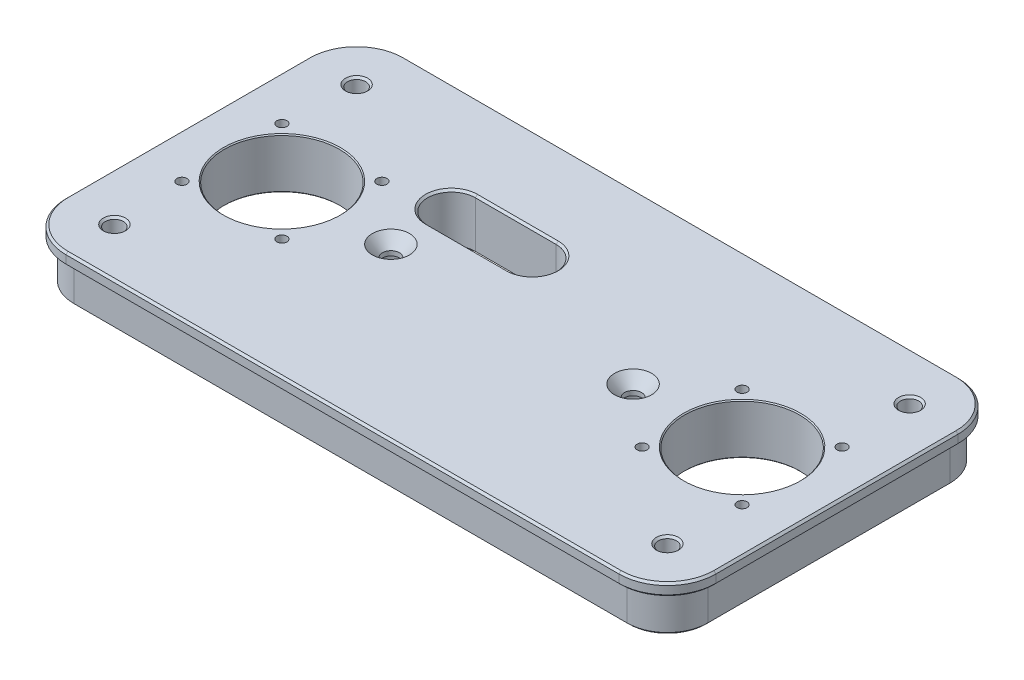
from build123d import *

# Parameters (mm, degrees)
SKETCH1_W                                            = 314
SKETCH1_H                                            = 160
BOSS_EXTRUDE1_DEPTH                                  = 25
SKETCH2_R                                            = 28.5
CUT_EXTRUDE1_DEPTH                                   = 178.971907896
CUT_EXTRUDE2_DEPTH                                   = 178.971907896
CUT_EXTRUDE2_DEPTH_BACK                              = 178.971907896
SKETCH4_R                                            = 9.55
CHAMFER1_SIZE                                        = 0.5
FILLET1_R                                            = 20
M8_CLEARANCE_HOLE1_D                                 = 9
M6X1_0_TAPPED_HOLE1_D                                = 5
SKETCH13_R                                           = 13.411040831
SKETCH13_R_2                                         = 14.724493856
BOSS_EXTRUDE3_DEPTH                                  = 8
CSK_FOR_5_16_FLAT_HEAD_SOCKET_CAP_SCREW1_D           = 8.4328
CSK_FOR_5_16_FLAT_HEAD_SOCKET_CAP_SCREW1_CSINK_D     = 18.4009792
CSK_FOR_5_16_FLAT_HEAD_SOCKET_CAP_SCREW1_CSINK_ANGLE = 82
BOSS_EXTRUDE4_DEPTH                                  = 6
CUT_EXTRUDE3_DEPTH                                   = 184.308483164
CHAMFER4_SIZE                                        = 1


with BuildPart() as part:
    # Sketch1 → Boss-Extrude1 (new body)
    with BuildSketch(Plane(origin=(0, 0, 0), x_dir=(1, 0, 0), z_dir=(0, 1, 0))):
        Rectangle(SKETCH1_W, SKETCH1_H)
    extrude(amount=BOSS_EXTRUDE1_DEPTH)

    # Sketch2 → Cut-Extrude1 (cut, through all)
    with BuildSketch(Plane(origin=(0, 25, 0), x_dir=(1, 0, 0), z_dir=(0, 1, 0))):
        with Locations((-114, 0)):
            Circle(SKETCH2_R)
        with Locations((114, 0)):
            Circle(SKETCH2_R)
    extrude(amount=-CUT_EXTRUDE1_DEPTH, mode=Mode.SUBTRACT)

    # Sketch4 → Cut-Extrude2 (cut, two sides: drawn at the far end of the back side and taken through both)
    with BuildSketch(Plane(origin=(0, 25, 0), x_dir=(1, 0, 0), z_dir=(0, 1, 0)).offset(-CUT_EXTRUDE2_DEPTH_BACK)):
        with Locations((-60, 0)):
            Circle(SKETCH4_R)
        with Locations((60, 0)):
            Circle(SKETCH4_R)
    extrude(amount=CUT_EXTRUDE2_DEPTH + CUT_EXTRUDE2_DEPTH_BACK, mode=Mode.SUBTRACT)

    # Chamfer1
    chamfer1_edges = [part.edges().sort_by_distance(p)[0] for p in [
        (85.5, 25, 0),
        (85.5, 0, 0),
        (50.45, 25, 0),
        (50.45, 0, 0),
        (-69.55, 25, 0),
        (-69.55, 0, 0),
        (-142.5, 25, 0),
        (-142.5, 0, 0),
    ]]
    chamfer(chamfer1_edges, length=CHAMFER1_SIZE)

    # Fillet1
    fillet1_edges = [part.edges().sort_by_distance(p)[0] for p in [
        (157, 12.5, 80),
        (157, 12.5, -80),
        (-157, 12.5, -80),
        (-157, 12.5, 80),
    ]]
    fillet(fillet1_edges, radius=FILLET1_R)

    # M8 Clearance Hole1 (through all)
    with Locations(Plane.XZ):
        with Locations((-137, -60), (-137, 60), (137, -60), (137, 60)):
            Hole(M8_CLEARANCE_HOLE1_D / 2)

    # M6x1.0 Tapped Hole1 (through all)
    with Locations(Plane(origin=(0, 0, 0), x_dir=(-1, 0, 0), z_dir=(0, -1, 0))):
        with Locations((138.765, -24.765), (89.235, -24.765), (89.235, 24.765), (138.765, 24.765), (-89.235, -24.765), (-138.765, -24.765), (-89.235, 24.765), (-138.765, 24.765)):
            Hole(M6X1_0_TAPPED_HOLE1_D / 2)

    # Sketch13 → Boss-Extrude3 (add)
    with BuildSketch(Plane(origin=(0, 25, 0), x_dir=(1, 0, 0), z_dir=(0, 1, 0))):
        with Locations((60, 0)):
            Circle(SKETCH13_R)
        with Locations((-60, 0)):
            Circle(SKETCH13_R_2)
    extrude(amount=-BOSS_EXTRUDE3_DEPTH)

    # CSK for 5/16 Flat Head Socket Cap Screw1 (through all)
    with Locations(Plane(origin=(0, 25, 0), x_dir=(1, 0, 0), z_dir=(0, 1, 0))):
        with Locations((60, 0), (-60, 0)):
            CounterSinkHole(CSK_FOR_5_16_FLAT_HEAD_SOCKET_CAP_SCREW1_D / 2, CSK_FOR_5_16_FLAT_HEAD_SOCKET_CAP_SCREW1_CSINK_D / 2, counter_sink_angle=CSK_FOR_5_16_FLAT_HEAD_SOCKET_CAP_SCREW1_CSINK_ANGLE)

    # Sketch16 → Boss-Extrude4 (add)
    with BuildSketch(Plane.XZ.offset(-25)):
        with BuildLine():
            Line((161, -60), (161, 60))
            ThreePointArc((161, 60), (153.970562748, 76.970562748), (137, 84))
            Line((137, 84), (-137, 84))
            ThreePointArc((-137, 84), (-153.970562748, 76.970562748), (-161, 60))
            Line((-161, 60), (-161, -60))
            ThreePointArc((-161, -60), (-153.970562748, -76.970562748), (-137, -84))
            Line((-137, -84), (137, -84))
            ThreePointArc((137, -84), (153.970562748, -76.970562748), (161, -60))
        make_face()
        with BuildLine():
            Line((157, 60), (157, -60))
            ThreePointArc((157, -60), (151.142135624, -74.142135624), (137, -80))
            Line((137, -80), (-137, -80))
            ThreePointArc((-137, -80), (-151.142135624, -74.142135624), (-157, -60))
            Line((-157, -60), (-157, 60))
            ThreePointArc((-157, 60), (-151.142135624, 74.142135624), (-137, 80))
            Line((-137, 80), (137, 80))
            ThreePointArc((137, 80), (151.142135624, 74.142135624), (157, 60))
        make_face(mode=Mode.SUBTRACT)
    extrude(amount=BOSS_EXTRUDE4_DEPTH)

    # Sketch17 → Cut-Extrude3 (cut, through all)
    with BuildSketch(Plane.XZ):
        with BuildLine():
            Line((-60, -18.184097247), (-20, -18.184097247))
            ThreePointArc((-20, -18.184097247), (-8.164859361, -30.019237886), (-20, -41.854378525))
            Line((-20, -41.854378525), (-60, -41.854378525))
            ThreePointArc((-60, -41.854378525), (-71.835140639, -30.019237886), (-60, -18.184097247))
        make_face()
    extrude(amount=-CUT_EXTRUDE3_DEPTH, mode=Mode.SUBTRACT)

    # Chamfer4
    chamfer4_edges = [part.edges().sort_by_distance(p)[0] for p in [
        (141.5, 0, -60),
        (141.5, 25, -60),
        (-132.5, 0, -60),
        (-132.5, 25, -60),
        (141.5, 0, 60),
        (141.5, 25, 60),
        (-132.5, 0, 60),
        (-132.5, 25, 60),
        (0, 19, -84),
        (153.970562748, 19, -76.970562748),
        (-153.970562748, 19, -76.970562748),
        (161, 19, 0),
        (-161, 19, 0),
        (153.970562748, 19, 76.970562748),
        (-153.970562748, 19, 76.970562748),
        (0, 19, 84),
        (0, 25, -84),
        (153.970562748, 25, -76.970562748),
        (-153.970562748, 25, -76.970562748),
        (161, 25, 0),
        (-161, 25, 0),
        (153.970562748, 25, 76.970562748),
        (-153.970562748, 25, 76.970562748),
        (0, 25, 84),
        (-40, 25, -18.184097247),
        (-71.835140639, 25, -30.019237886),
        (-8.164859361, 25, -30.019237886),
        (-40, 25, -41.854378525),
        (-40, 0, -18.184097247),
        (-71.835140639, 0, -30.019237886),
        (-8.164859361, 0, -30.019237886),
        (-40, 0, -41.854378525),
        (0, 0, -80),
        (-151.142135624, 0, -74.142135624),
        (151.142135624, 0, -74.142135624),
        (-157, 0, 0),
        (157, 0, 0),
        (-151.142135624, 0, 74.142135624),
        (151.142135624, 0, 74.142135624),
        (0, 0, 80),
    ]]
    chamfer(chamfer4_edges, length=CHAMFER4_SIZE)


solid = part.part
